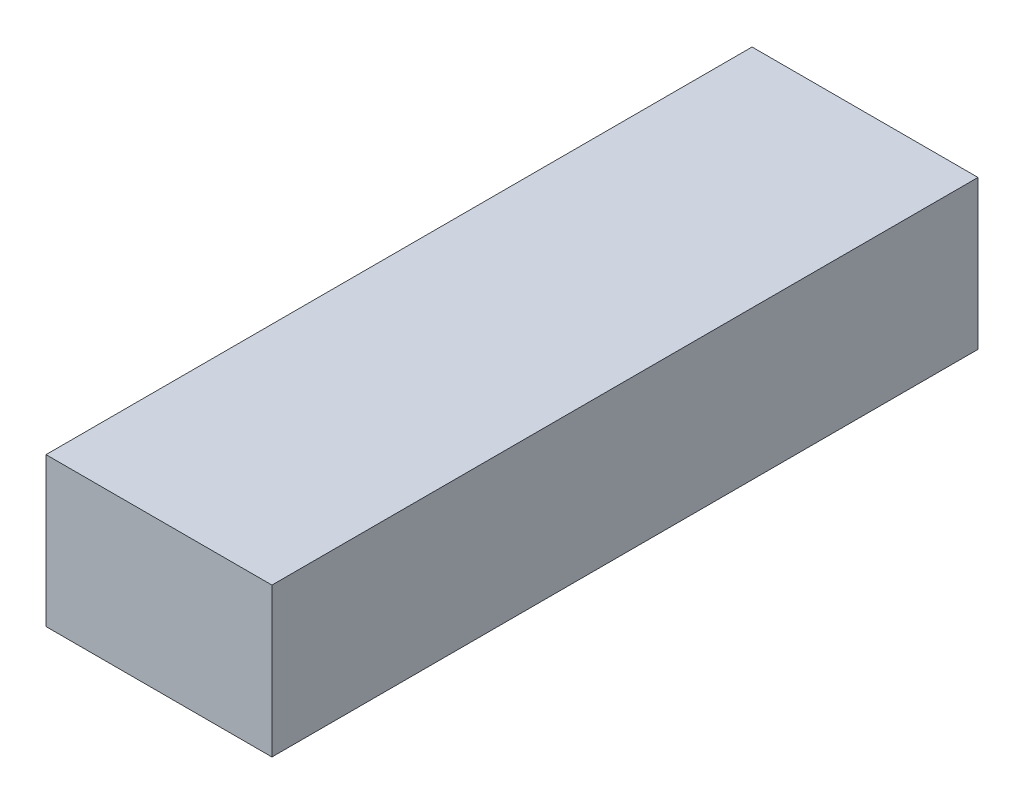
from build123d import *

# Parameters (mm, degrees)
SKETCH1_W           = 44
SKETCH1_H           = 137.5
BOSS_EXTRUDE1_DEPTH = 29


with BuildPart() as part:
    # Sketch1 → Boss-Extrude1 (new body)
    with BuildSketch(Plane(origin=(0, 0, 0), x_dir=(1, 0, 0), z_dir=(0, 1, 0))):
        with Locations((22, 68.75)):
            Rectangle(SKETCH1_W, SKETCH1_H)
    extrude(amount=BOSS_EXTRUDE1_DEPTH)


solid = part.part
